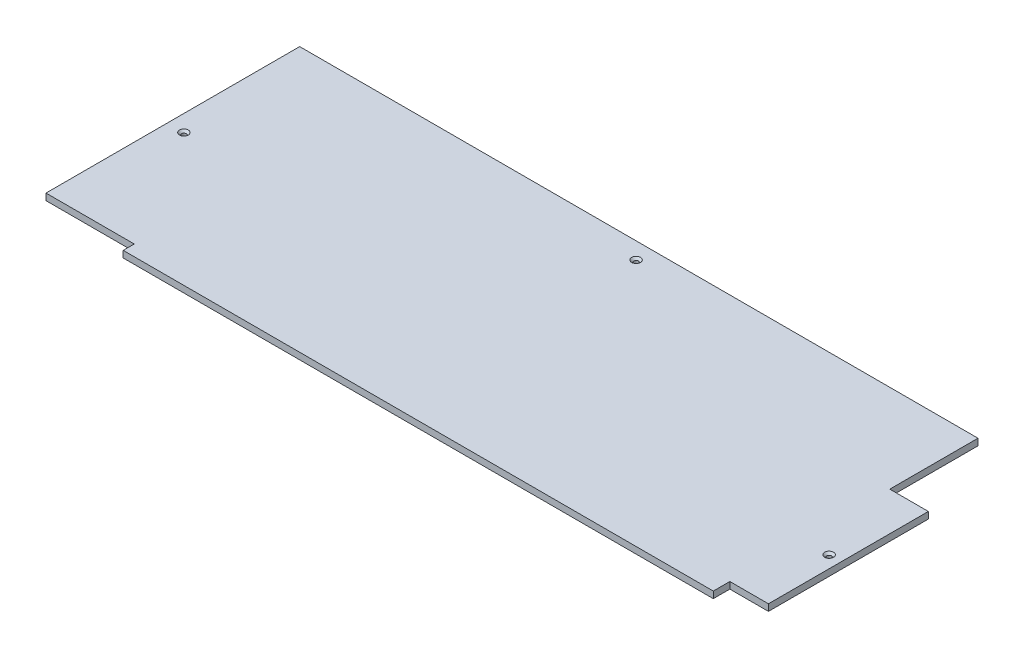
from build123d import *

# Parameters (mm, degrees)
SKETCH1_W                                       = 650
SKETCH1_H                                       = 240
BOSS_EXTRUDE1_DEPTH                             = 6
SKETCH2_W                                       = 42.755787086
SKETCH2_H                                       = 96.814819366
SKETCH2_W_2                                     = 92.11131486
SKETCH2_H_2                                     = 17.87958298
SKETCH2_W_3                                     = 47.933434696
SKETCH2_H_3                                     = 25.229345572
CUT_EXTRUDE1_DEPTH                              = 347.498196244
CSK_FOR_M4_FLAT_HEAD_MACHINE_SCREW1_D           = 4.2
CSK_FOR_M4_FLAT_HEAD_MACHINE_SCREW1_CSINK_D     = 8
CSK_FOR_M4_FLAT_HEAD_MACHINE_SCREW1_CSINK_ANGLE = 90


with BuildPart() as part:
    # Sketch1 → Boss-Extrude1 (new body)
    with BuildSketch(Plane(origin=(0, 0, 0), x_dir=(1, 0, 0), z_dir=(0, 1, 0))):
        Rectangle(SKETCH1_W, SKETCH1_H)
    extrude(amount=BOSS_EXTRUDE1_DEPTH)

    # Sketch2 → Cut-Extrude1 (cut, through all)
    with BuildSketch(Plane(origin=(0, 6, 0), x_dir=(1, 0, 0), z_dir=(0, 1, 0))):
        with Locations((311.377893543, 88.407409683)):
            Rectangle(SKETCH2_W, SKETCH2_H)
        with Locations((-291.05565743, -118.93979149)):
            Rectangle(SKETCH2_W_2, SKETCH2_H_2)
        with Locations((313.966717348, -117.614672786)):
            Rectangle(SKETCH2_W_3, SKETCH2_H_3)
    extrude(amount=-CUT_EXTRUDE1_DEPTH, mode=Mode.SUBTRACT)

    # CSK for M4 Flat Head Machine Screw1 (through all)
    with Locations(Plane(origin=(0, 6, 0), x_dir=(1, 0, 0), z_dir=(0, 1, 0))):
        with Locations((-310, 0), (-5, 105), (314, -39)):
            CounterSinkHole(CSK_FOR_M4_FLAT_HEAD_MACHINE_SCREW1_D / 2, CSK_FOR_M4_FLAT_HEAD_MACHINE_SCREW1_CSINK_D / 2, counter_sink_angle=CSK_FOR_M4_FLAT_HEAD_MACHINE_SCREW1_CSINK_ANGLE)


solid = part.part
